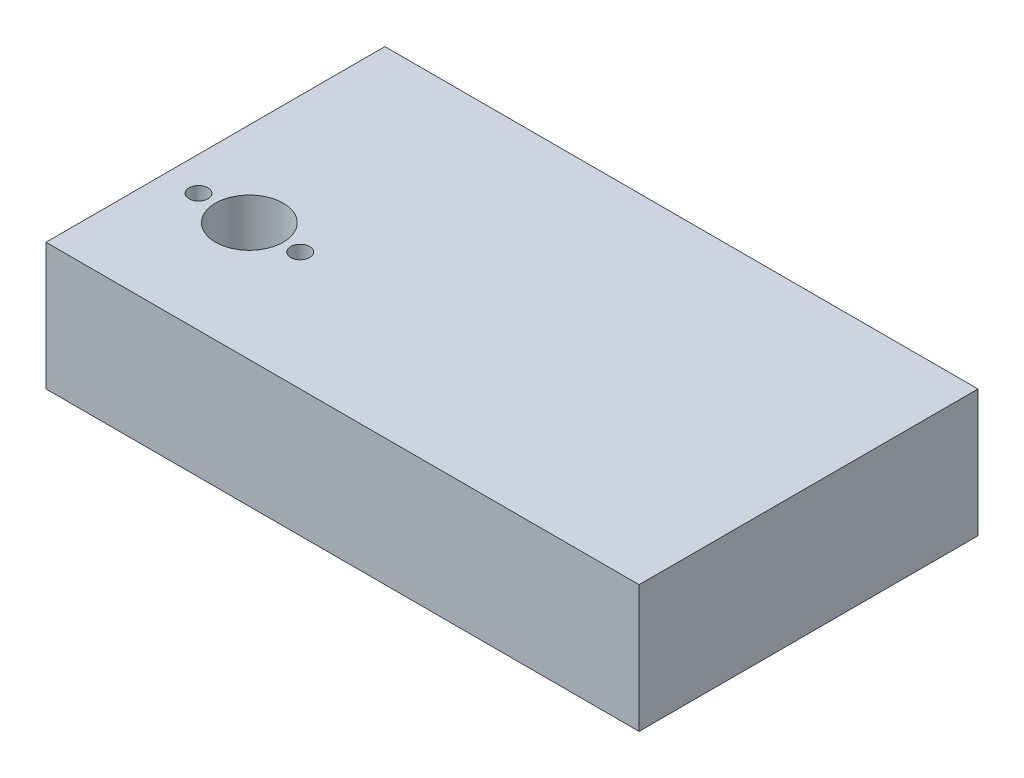
from build123d import *

# Parameters (mm, degrees)
SKETCH1_W              = 140
SKETCH1_H              = 30
BOSS_EXTRUDE1_DEPTH    = 80
SKETCH2_R              = 4.17592015
CUT_EXTRUDE1_DEPTH     = 15
LPATTERN1_COUNT        = 4
LPATTERN1_PITCH        = 110
SKETCH_1_R             = 25
CUT_EXTRUDE_1_DEPTH    = 10.5
SKETCH_2_R             = 5
CUT_EXTRUDE_2_DEPTH    = 10.5
SKETCH_3_R             = 8
CUT_EXTRUDE_3_DEPTH    = 100
SKETCH_4_R             = 10
CUT_EXTRUDE_4_DEPTH    = 10.5
SKETCH_5_R             = 2.25
CUT_EXTRUDE_5_DEPTH    = 10.5
PATTERN_LINEAR_1_COUNT = 2
PATTERN_LINEAR_1_PITCH = 24


with BuildPart() as part:
    # Sketch1 → Boss-Extrude1 (new body)
    with BuildSketch(Plane.XY):
        with Locations((24.869684499, 8.141289438)):
            Rectangle(SKETCH1_W, SKETCH1_H)
    extrude(amount=BOSS_EXTRUDE1_DEPTH)

    # Sketch2 → Cut-Extrude1 (cut)
    with BuildSketch(Plane(origin=(0, 0, 0), x_dir=(-1, 0, 0), z_dir=(0, 0, -1))):
        with Locations((30.130315501, 7.814471991)):
            Circle(SKETCH2_R)
    cut_extrude1 = extrude(amount=-CUT_EXTRUDE1_DEPTH, mode=Mode.SUBTRACT)

    # LPattern1: Cut-Extrude1 ×4
    with Locations(*[(i * LPATTERN1_PITCH, 0, 0) for i in range(1, LPATTERN1_COUNT)]):
        add(cut_extrude1, mode=Mode.SUBTRACT)

    # Эскиз1 → Вырез-Вытянуть1 (cut)
    with BuildSketch(Plane.XZ.offset(6.858710562)):
        with Locations((-5.130315501, 33)):
            Circle(SKETCH_1_R)
    extrude(amount=-CUT_EXTRUDE_1_DEPTH, mode=Mode.SUBTRACT)

    # Эскиз2 → Вырез-Вытянуть2 (cut)
    with BuildSketch(Plane.XZ.offset(-3.641289438)):
        with Locations((-5.130315501, 33)):
            Circle(SKETCH_2_R)
    extrude(amount=-CUT_EXTRUDE_2_DEPTH, mode=Mode.SUBTRACT)

    # Эскиз3 → Вырез-Вытянуть3 (cut)
    with BuildSketch(Plane.XZ.offset(6.858710562)):
        with Locations((-25.130315501, 52)):
            Circle(SKETCH_3_R)
    extrude(amount=-CUT_EXTRUDE_3_DEPTH, mode=Mode.SUBTRACT)

    # Эскиз4 → Вырез-Вытянуть4 (cut)
    with BuildSketch(Plane.XZ.offset(6.858710562)):
        with Locations((-25.130315501, 52)):
            Circle(SKETCH_4_R)
    extrude(amount=-CUT_EXTRUDE_4_DEPTH, mode=Mode.SUBTRACT)

    # Эскиз5 → Вырез-Вытянуть5 (cut)
    with BuildSketch(Plane(origin=(0, 23.141289438, 0), x_dir=(1, 0, 0), z_dir=(0, 1, 0))):
        with Locations((-37.130315501, -52)):
            Circle(SKETCH_5_R)
    cut_extrude_5 = extrude(amount=-CUT_EXTRUDE_5_DEPTH, mode=Mode.SUBTRACT)

    # Линейный массив1: Вырез-Вытянуть5 ×2
    with Locations(*[(i * PATTERN_LINEAR_1_PITCH, 0, 0) for i in range(1, PATTERN_LINEAR_1_COUNT)]):
        add(cut_extrude_5, mode=Mode.SUBTRACT)


solid = part.part
